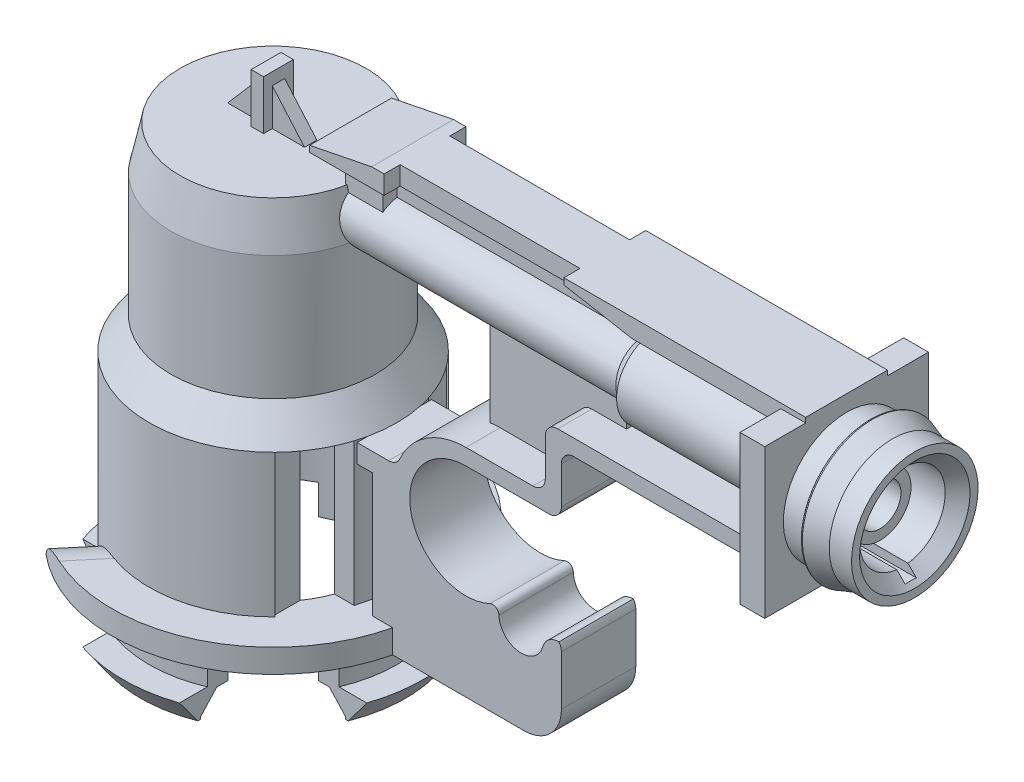
from build123d import *
from build123d.topology import SkipClean

# Parameters (mm, degrees)
SHELL1_T                        = -1.5
CUT_EXTRUDE3_START              = 33.397254902
SKETCH5_R                       = 6.75
CUT_EXTRUDE3_DEPTH              = 33.397254902
SKETCH7_R                       = 6.75
SKETCH7_R_2                     = 6.25
BOSS_EXTRUDE1_DEPTH             = 2.5
SKETCH13_W                      = 13.2
SKETCH13_H                      = 12
BOSS_EXTRUDE2_DEPTH             = 2
BOSS_EXTRUDE3_DEPTH             = 3.3
BOSS_EXTRUDE3_DEPTH_BACK        = 3.3
BOSS_EXTRUDE4_DEPTH             = 2
BOSS_EXTRUDE4_DEPTH_BACK        = 2
SKETCH15_W                      = 20
SKETCH15_H                      = 1.5
BOSS_EXTRUDE5_REACH             = 58.262
BOSS_EXTRUDE5_DIRECTION_2_REACH = 58.262
BOSS_EXTRUDE7_DEPTH             = 0.25
BOSS_EXTRUDE7_DEPTH_BACK        = 0.25
SKETCH17_W                      = 18.5
SKETCH17_H                      = 3.67461891
BOSS_EXTRUDE8_DEPTH             = 1.4
BOSS_EXTRUDE8_DEPTH_BACK        = 1.4
SKETCH19_W                      = 3
SKETCH19_H                      = 3.562043861
BOSS_EXTRUDE9_DEPTH             = 3
BOSS_EXTRUDE9_DEPTH_BACK        = 3
FILLET1_R                       = 1
FILLET3_R                       = 1
FILLET4_R                       = 1
FILLET5_R                       = 0.5
FILLET6_R                       = 1
FILLET7_R                       = 3
SKETCH22_W                      = 3
SKETCH22_H                      = 1.9
BOSS_EXTRUDE10_DEPTH            = 0.25
BOSS_EXTRUDE10_DEPTH_BACK       = 0.25
SKETCH32_W                      = 3
SKETCH32_H                      = 1.9
CUT_REVOLVE1_ANGLE              = 50
CUT_REVOLVE1_OTHER_WAY_ANGLE    = 50
CUT_EXTRUDE5_START              = -0.002745098
CUT_EXTRUDE5_OUTLINE_R          = 31.844450997
CUT_EXTRUDE5_DEPTH              = 4.002745098
FILLET8_R                       = 4
FILLET9_R                       = 4
SKETCH40_R                      = 3.45
CUT_EXTRUDE6_DEPTH              = 5.5
CHAMFER1_SIZE                   = 1
CUT_EXTRUDE7_REACH              = 72.603
SKETCH42_W                      = 0.9
SKETCH42_H                      = 8.2
SKETCH43_R                      = 2.5
BOSS_EXTRUDE11_DEPTH            = 2.7
BOSS_EXTRUDE12_DEPTH            = 0.5
BOSS_EXTRUDE12_DEPTH_BACK       = 0.5
BOSS_EXTRUDE13_DEPTH            = 1.2
BOSS_EXTRUDE13_DEPTH_BACK       = 1.2
SKETCH48_W                      = 4
SKETCH48_H                      = 4
CUT_EXTRUDE9_DEPTH              = 11.497255


with BuildPart() as part:
    # Sketch1 → Revolve1 (revolve)
    with BuildSketch(Plane.XY):
        Polygon((1.5, 7.717254902), (1.5, -27.182745098), (-8.5, -27.182745098), (-8.5, -8.282745098), (-6.75, -5.782745098), (-6.75, 4.217254902), (-6, 7.717254902), align=None)
    revolve(axis=Axis((1.5, 7.717254902, 0), (0, -1, 0)))

    # Shell1
    shell1_openings = [part.faces().sort_by_distance(p)[0] for p in [
        (1.5, -27.182745098, 0),
    ]]
    offset(amount=SHELL1_T, openings=shell1_openings, kind=Kind.INTERSECTION)

    # Sketch5 → Cut-Extrude3 (cut)
    with BuildSketch(Plane(origin=(0, -27.18, 0), x_dir=(1, 0, 0), z_dir=(0, 1, 0)).offset(CUT_EXTRUDE3_START)):
        with Locations(Location((1.5, 0, 0), (0, 0, 180))):
            Circle(SKETCH5_R)
    extrude(amount=-CUT_EXTRUDE3_DEPTH, mode=Mode.SUBTRACT)

    # Sketch7 → Boss-Extrude1 (add)
    with BuildSketch(Plane.XZ.offset(-6.217254902)):
        with Locations((1.5, 0)):
            Circle(SKETCH7_R)
        with Locations((1.5, 0)):
            Circle(SKETCH7_R_2, mode=Mode.SUBTRACT)
    extrude(amount=BOSS_EXTRUDE1_DEPTH)

    # Sketch11 → Revolve2 (revolve)
    with BuildSketch(Plane.XY, mode=Mode.PRIVATE) as revolve2_sk:
        Polygon((-8.5, -27.182745098), (-9.2, -27.182745098), (-10.600415076, -25.182745098), (-8.5, -25.182745098), align=None)
    revolve(revolve2_sk.sketch.rotate(Axis((1.5, 7.717254902, 0), (0, 1, 0)), 180), axis=Axis((1.5, 7.717254902, 0), (0, 1, 0)))

    # Sketch12 → Revolve3 (revolve)
    with SkipClean():  # the faces are left unmerged after this step: merging them gives an invalid solid
        with BuildSketch(Plane.XY):
            Polygon((9, 7.717254902), (31.4, 7.717254902), (32.4, 8.667254902), (45.75, 8.667254902), (45.75, 5.467254902), (9, 5.467254902), (8.8, 5.467254902), (8.8, 7.717254902), align=None)
        revolve(axis=Axis((45.75, 5.467254902, 0), (-1, 0, 0)))

    # Sketch13 → Boss-Extrude2 (add)
    with BuildSketch(Plane(origin=(45.75, 0, 0), x_dir=(0, 0, -1), z_dir=(1, 0, 0))):
        with Locations((0, 5.467254902)):
            Rectangle(SKETCH13_W, SKETCH13_H)
    extrude(amount=BOSS_EXTRUDE2_DEPTH)

    # Sketch14 → Boss-Extrude3 (add, two sides: drawn at the far end of the back side and taken through both)
    with BuildSketch(Plane.XY.offset(-BOSS_EXTRUDE3_DEPTH_BACK)):
        Polygon((47.75, 10.363298717), (33.75, 10.363298717), (28.25, 11.363298717), (28.25, 11.863298717), (47.75, 11.863298717), align=None)
    extrude(amount=BOSS_EXTRUDE3_DEPTH + BOSS_EXTRUDE3_DEPTH_BACK)

    # Sketch15 → Boss-Extrude4 (add, two sides: drawn at the far end of the back side and taken through both)
    with BuildSketch(Plane.XY.offset(-BOSS_EXTRUDE4_DEPTH_BACK)):
        with Locations((23.75, 11.113298717)):
            Rectangle(SKETCH15_W, SKETCH15_H)
    extrude(amount=BOSS_EXTRUDE4_DEPTH + BOSS_EXTRUDE4_DEPTH_BACK)

    # Boss-Extrude5: up to this face of the body (flat: up to its plane)
    boss_extrude5_end = Plane(part.part.faces().sort_by_distance((38.100921754, 11.178465959, 3.3))[0])
    # Sketch16 → Boss-Extrude5 (add, up to the picked face)
    with BuildSketch(Plane.XY, mode=Mode.PRIVATE) as boss_extrude5_sk1:
        Polygon((13.75, 11.863298717), (12.75, 11.863298717), (7.75, 10.863298717), (7.75, 10.363298717), (13.75, 10.363298717), align=None)
    boss_extrude5_tool1 = split(extrude(boss_extrude5_sk1.sketch, amount=BOSS_EXTRUDE5_REACH, mode=Mode.PRIVATE), bisect_by=boss_extrude5_end, keep=Keep.BOTH, mode=Mode.PRIVATE)
    add(boss_extrude5_tool1.solids().sort_by(Axis((11.262821, 10.953042, 0), (0, 0, 1)))[0])

    # Boss-Extrude5 direction 2: up to this face of the body (flat: up to its plane)
    boss_extrude5_direction_2_end = Plane(part.part.faces().sort_by_distance((38.100921754, 11.178465959, -3.3))[0])
    # Sketch16 → Boss-Extrude5 direction 2 (add, up to the picked face)
    with BuildSketch(Plane.XY, mode=Mode.PRIVATE) as boss_extrude5_direction_2_sk1:
        Polygon((13.75, 11.863298717), (12.75, 11.863298717), (7.75, 10.863298717), (7.75, 10.363298717), (13.75, 10.363298717), align=None)
    boss_extrude5_direction_2_tool1 = split(extrude(boss_extrude5_direction_2_sk1.sketch, amount=-BOSS_EXTRUDE5_DIRECTION_2_REACH, mode=Mode.PRIVATE), bisect_by=boss_extrude5_direction_2_end, keep=Keep.BOTH, mode=Mode.PRIVATE)
    add(boss_extrude5_direction_2_tool1.solids().sort_by(Axis((11.262821, 10.953042, 0), (0, 0, -1)))[0])

    # Sketch17 → Boss-Extrude7 (add, two sides: drawn at the far end of the back side and taken through both)
    with BuildSketch(Plane.XY.offset(-BOSS_EXTRUDE7_DEPTH_BACK)):
        with Locations((21, 8.525989262)):
            Rectangle(SKETCH17_W, SKETCH17_H)
    extrude(amount=BOSS_EXTRUDE7_DEPTH + BOSS_EXTRUDE7_DEPTH_BACK)

    # Sketch19 → Boss-Extrude8 (add, two sides: drawn at the far end of the back side and taken through both)
    with BuildSketch(Plane.XY.offset(-BOSS_EXTRUDE8_DEPTH_BACK)):
        with Locations((10.25, 8.582276787)):
            Rectangle(SKETCH19_W, SKETCH19_H)
    extrude(amount=BOSS_EXTRUDE8_DEPTH + BOSS_EXTRUDE8_DEPTH_BACK)

    # Sketch21 → Boss-Extrude9 (add, two sides: drawn at the far end of the back side and taken through both)
    with BuildSketch(Plane.XY.offset(-BOSS_EXTRUDE9_DEPTH_BACK)):
        with BuildLine():
            Line((47.75, -0.532745098), (27.75, -0.532745098))
            Line((27.75, -0.532745098), (27.75, -5.532745098))
            Line((27.75, -5.532745098), (20.057694357, -5.532745098))
            ThreePointArc((20.057694357, -5.532745098), (15.859979082, -11.796072405), (23.248758975, -13.298075789))
            ThreePointArc((23.248758975, -13.298075789), (23.604980618, -16.131341412), (26.25, -15.055162793))
            ThreePointArc((26.25, -15.055162793), (26.732730755, -14.34028924), (27.55, -14.064346929))
            Line((27.55, -14.064346929), (27.75, -14.064346929))
            Line((27.75, -14.064346929), (27.75, -21.68))
            Line((27.75, -21.68), (12.5, -21.68))
            Line((12.5, -21.68), (12.5, -9.782745098))
            Line((12.5, -9.782745098), (11.275044878, -9.782745098))
            Line((11.275044878, -9.782745098), (11.275044878, -8.282745098))
            Line((11.275044878, -8.282745098), (11.5, -8.282745098))
            Line((11.5, -8.282745098), (14.5, -8.282745098))
            ThreePointArc((14.5, -8.282745098), (16.619291146, -5.352656002), (20.057694357, -4.232745098))
            Line((20.057694357, -4.232745098), (26.45, -4.232745098))
            Line((26.45, -4.232745098), (26.45, 0.767254902))
            Line((26.45, 0.767254902), (47.75, 0.767254902))
            Line((47.75, 0.767254902), (47.75, -0.532745098))
        make_face()
    extrude(amount=BOSS_EXTRUDE9_DEPTH + BOSS_EXTRUDE9_DEPTH_BACK)

    # Fillet1
    fillet1_edges = [part.edges().sort_by_distance(p)[0] for p in [
        (27.75, -5.532745098, 0),
        (26.45, -4.232745098, 0),
    ]]
    fillet(fillet1_edges, radius=FILLET1_R)

    # Fillet3
    # the kernel refuses this fillet: 1 mm, written as the material it takes off along each edge
    with BuildSketch(Plane(origin=(27.75, -14.064346929, 4.5), x_dir=(-1, 0, 0), z_dir=(0, 0, -1))) as fillet3_piece_1:
        with BuildLine():
            CenterArc((1, -0.6), FILLET3_R, 143.130102354, 36.869897646)
            Line((0, -0.6), (-0.02, -0.6))
            Line((-0.02, -0.6), (-0.02, 0))
            Line((-0.02, 0), (0, 0.02))
            ThreePointArc((0, 0.02), (0.1, 0.02), (0.184, 0.012))
            Line((0.184, 0.012), (0.2, 0))
        make_face()
    extrude(amount=9, mode=Mode.SUBTRACT)

    # Fillet4
    fillet4_edges = [part.edges().sort_by_distance(p)[0] for p in [
        (27.75, -0.532745098, 0),
        (26.45, 0.767254902, 0),
    ]]
    fillet(fillet4_edges, radius=FILLET4_R)

    # Fillet5
    fillet5_edges = [part.edges().sort_by_distance(p)[0] for p in [
        (23.248758975, -13.298075789, 0),
    ]]
    fillet(fillet5_edges, radius=FILLET5_R)

    # Fillet6
    fillet6_edges = [part.edges().sort_by_distance(p)[0] for p in [
        (14.5, -8.282745098, 0),
    ]]
    fillet(fillet6_edges, radius=FILLET6_R)

    # Fillet7
    fillet7_edges = [part.edges().sort_by_distance(p)[0] for p in [
        (27.75, -21.68, 0),
    ]]
    fillet(fillet7_edges, radius=FILLET7_R)

    # Sketch22 → Revolve4 (revolve)
    with BuildSketch(Plane.XY, mode=Mode.PRIVATE) as revolve4_sk:
        with Locations((-10, -20.73)):
            Rectangle(SKETCH22_W, SKETCH22_H)
    revolve(revolve4_sk.sketch.rotate(Axis((1.5, -25.182745098, 0), (0, 1, 0)), 180), axis=Axis((1.5, -25.182745098, 0), (0, 1, 0)))

    # Sketch23 → Boss-Extrude10 (add, two sides: drawn at the far end of the back side and taken through both)
    with BuildSketch(Plane.XY.offset(-BOSS_EXTRUDE10_DEPTH_BACK)):
        Polygon((30.25, 3.217254902), (30.25, 0.322848826), (27.550920774, 0), (27.020024858, -3.434260731), (25.876556732, -5.149462921), (19.25, -5.149462921), (19.25, 3.217254902), (19.25, 3.761165923), (30.25, 3.761165923), align=None)
    extrude(amount=BOSS_EXTRUDE10_DEPTH + BOSS_EXTRUDE10_DEPTH_BACK)

    # Sketch32 → Cut-Revolve1 (revolve, cut)
    with BuildSketch(Plane.XY):
        with Locations((-10, -20.73)):
            Rectangle(SKETCH32_W, SKETCH32_H)
    revolve(axis=Axis((1.5, 7.717254902, 0), (0, 1, 0)), revolution_arc=CUT_REVOLVE1_ANGLE, mode=Mode.SUBTRACT)

    # Sketch32 → Cut-Revolve1 other way (revolve, cut)
    with BuildSketch(Plane.XY):
        with Locations((-10, -20.73)):
            Rectangle(SKETCH32_W, SKETCH32_H)
    revolve(axis=Axis((1.5, 7.717254902, 0), (0, -1, 0)), revolution_arc=CUT_REVOLVE1_OTHER_WAY_ANGLE, mode=Mode.SUBTRACT)

    # Cut-Extrude5: read off the stored shape, not the designer's step
    # Cut-Extrude5 outline → Cut-Extrude5 (cut)
    with BuildSketch(Plane(origin=(0, -27.18, 0), x_dir=(1, 0, 0), z_dir=(0, 1, 0)).offset(CUT_EXTRUDE5_START)):
        with Locations((1.5, 0)):
            Circle(CUT_EXTRUDE5_OUTLINE_R)
        with BuildLine():
            Line((-6.052483035, -3.9), (-19.004507657, -3.9))
            Line((-19.004507657, -3.9), (-19.004507657, 3.9))
            Line((-19.004507657, 3.9), (-6.052483035, 3.9))
            ThreePointArc((-6.052483035, 3.9), (-4.51040764, 6.01040764), (-2.4, 7.552483035))
            Line((-2.4, 7.552483035), (-2.4, 21.350285955))
            Line((-2.4, 21.350285955), (5.4, 21.350285955))
            Line((5.4, 21.350285955), (5.4, 7.552483035))
            ThreePointArc((5.4, 7.552483035), (7.51040764, 6.01040764), (9.052483035, 3.9))
            Line((9.052483035, 3.9), (22.004507657, 3.9))
            Line((22.004507657, 3.9), (22.004507657, -3.9))
            Line((22.004507657, -3.9), (9.052483035, -3.9))
            ThreePointArc((9.052483035, -3.9), (7.51040764, -6.01040764), (5.4, -7.552483035))
            Line((5.4, -7.552483035), (5.4, -21.350285955))
            Line((5.4, -21.350285955), (-2.4, -21.350285955))
            Line((-2.4, -21.350285955), (-2.4, -7.552483035))
            ThreePointArc((-2.4, -7.552483035), (-4.51040764, -6.01040764), (-6.052483035, -3.9))
        make_face(mode=Mode.SUBTRACT)
    extrude(amount=CUT_EXTRUDE5_DEPTH, mode=Mode.SUBTRACT)

    # Fillet8
    # the kernel refuses this fillet: 4 mm, written as the material it takes off along each edge
    with BuildSketch(Plane(origin=(0.542903561, -19.78, 1.14062312), x_dir=(0, -1, 0), z_dir=(-0.6427876096865379, 0, 0.7660444431189792))) as fillet8_piece_1_section:
        with BuildLine():
            CenterArc((4, 3.404408906), FILLET8_R, 180, 58.331756746)
            Line((0, 3.404408906), (0, 0))
            Line((0, 0), (1.9, 0))
        make_face()
    fillet8_piece_1 = extrude(amount=20.022044531, mode=Mode.PRIVATE)
    fillet8_piece_1 = fillet8_piece_1 - Plane(origin=(1.5, -19.78, 0), x_dir=(-1, 0, 0), z_dir=(0, 1, 0)) * Cylinder(10, 54, mode=Mode.PRIVATE)
    add(fillet8_piece_1, mode=Mode.SUBTRACT)

    # Fillet9
    # the kernel refuses this fillet: 4 mm, written as the material it takes off along each edge
    with BuildSketch(Plane(origin=(0.542903561, -19.78, -1.14062312), x_dir=(0.7660444431189792, 0, -0.6427876096865379), z_dir=(-0.6427876096865379, 0, -0.7660444431189792))) as fillet9_piece_1_section:
        with BuildLine():
            CenterArc((3.404408906, 4), FILLET9_R, 211.668243254, 58.331756746)
            Line((0, 1.9), (0, 0))
            Line((0, 0), (3.404408906, 0))
        make_face()
    fillet9_piece_1 = extrude(amount=20.022044531, mode=Mode.PRIVATE)
    fillet9_piece_1 = fillet9_piece_1 - Plane(origin=(1.5, -19.78, 0), x_dir=(-1, 0, 0), z_dir=(0, 1, 0)) * Cylinder(10, 54, mode=Mode.PRIVATE)
    add(fillet9_piece_1, mode=Mode.SUBTRACT)

    # Sketch38 → Cut-Revolve2 (revolve, cut)
    with BuildSketch(Plane.XY, mode=Mode.PRIVATE) as cut_revolve2_sk:
        Polygon((1.5, -25.579631782), (1.5, -29.139743627), (-9, -29.139743627), (-9, -27.007866965), (-7.8, -25.579631782), align=None)
    revolve(cut_revolve2_sk.sketch.rotate(Axis((1.5, 7.717254902, 0), (0, 1, 0)), 180), axis=Axis((1.5, 7.717254902, 0), (0, 1, 0)), mode=Mode.SUBTRACT)

    # Sketch39 → Revolve7 (revolve)
    with BuildSketch(Plane.XY):
        with BuildLine():
            Line((47.75, 5.467254902), (47.75, 10.567254902))
            Line((47.75, 10.567254902), (49.55, 10.567254902))
            Line((49.55, 10.567254902), (49.55, 10.767254902))
            Line((49.55, 10.767254902), (49.651722542, 10.997924534))
            ThreePointArc((49.651722542, 10.997924534), (49.725493918, 11.084766154), (49.834718836, 11.117225362))
            Line((49.834718836, 11.117225362), (51.45, 10.567254902))
            Line((51.45, 10.567254902), (53.25, 10.567254902))
            Line((53.25, 10.567254902), (53.25, 5.467254902))
            Line((53.25, 5.467254902), (47.75, 5.467254902))
        make_face()
    revolve(axis=Axis((53.25, 5.467254902, 0), (-1, 0, 0)))

    # Sketch40 → Cut-Extrude6 (cut)
    with BuildSketch(Plane(origin=(53.25, 0, 0), x_dir=(0, 0, -1), z_dir=(1, 0, 0))):
        with Locations(Location((0, 5.467254902, 0), (0, 0, 90))):
            Circle(SKETCH40_R)
    extrude(amount=-CUT_EXTRUDE6_DEPTH, mode=Mode.SUBTRACT)

    # Chamfer1
    chamfer1_edges = [part.edges().sort_by_distance(p)[0] for p in [
        (53.25, 2.017254902, 0),
    ]]
    chamfer(chamfer1_edges, length=CHAMFER1_SIZE)

    # Cut-Extrude7: up to this face of the body (flat: up to its plane)
    cut_extrude7_end = Plane(part.part.faces().sort_by_distance((47.75, 5.467254902, 0))[0])
    # Sketch42 → Cut-Extrude7 (cut, up to the picked face)
    with BuildSketch(Plane(origin=(53.25, 0, 0), x_dir=(0, 0, -1), z_dir=(1, 0, 0)), mode=Mode.PRIVATE) as cut_extrude7_sk1:
        with Locations((0, 5.467254902)):
            Rectangle(SKETCH42_W, SKETCH42_H)
    cut_extrude7_tool1 = split(extrude(cut_extrude7_sk1.sketch, amount=-CUT_EXTRUDE7_REACH, mode=Mode.PRIVATE), bisect_by=cut_extrude7_end, keep=Keep.BOTH, mode=Mode.PRIVATE)
    add(cut_extrude7_tool1.solids().sort_by(Axis((53.25, 5.467255, 0), (-1, 0, 0)))[0], mode=Mode.SUBTRACT)

    # Sketch43 → Boss-Extrude11 (add)
    with BuildSketch(Plane(origin=(47.75, 0, 0), x_dir=(0, 0, -1), z_dir=(1, 0, 0))):
        with Locations(Location((0, 5.467254902, 0), (0, 0, 180))):
            Circle(SKETCH43_R)
    extrude(amount=BOSS_EXTRUDE11_DEPTH)

    # Sketch45 → Cut-Revolve3 (revolve, cut)
    with BuildSketch(Plane.XY, mode=Mode.PRIVATE) as cut_revolve3_sk:
        Polygon((53.25, 5.467254902), (7.042638454, 5.467254902), (7.042638454, 6.217254902), (38.685920052, 6.217254902), (41.25, 7.150503681), (53.25, 7.150503681), align=None)
    revolve(cut_revolve3_sk.sketch.rotate(Axis((53.25, 5.467254902, 0), (-1, 0, 0)), 90), axis=Axis((53.25, 5.467254902, 0), (-1, 0, 0)), mode=Mode.SUBTRACT)

    # Sketch46 → Boss-Extrude12 (add, two sides: drawn at the far end of the back side and taken through both)
    with BuildSketch(Plane.XY.offset(-BOSS_EXTRUDE12_DEPTH_BACK)):
        Polygon((1.434087404, 10.717254902), (0.934087404, 10.717254902), (-1.665912596, 7.717254902), (-1.665912596, 7.517254902), (1.434087404, 7.517254902), (4.534087404, 7.517254902), (4.534087404, 7.717254902), (1.934087404, 10.717254902), align=None)
    extrude(amount=BOSS_EXTRUDE12_DEPTH + BOSS_EXTRUDE12_DEPTH_BACK)

    # Sketch47 → Boss-Extrude13 (add, two sides: drawn at the far end of the back side and taken through both)
    with BuildSketch(Plane.XY.offset(-BOSS_EXTRUDE13_DEPTH_BACK)):
        Polygon((1.934087404, 10.717254902), (1.934087404, 11.697254902), (0.934087404, 11.697254902), (0.934087404, 10.717254902), (0.934087404, 7.717254902), (1.934087404, 7.717254902), align=None)
    extrude(amount=BOSS_EXTRUDE13_DEPTH + BOSS_EXTRUDE13_DEPTH_BACK)

    # Sketch48 → Cut-Extrude9 (cut)
    with BuildSketch(Plane(origin=(0, -19.78, 0), x_dir=(1, 0, 0), z_dir=(0, 1, 0))):
        with Locations((10.5, -5)):
            Rectangle(SKETCH48_W, SKETCH48_H)
    cut_extrude9 = extrude(amount=CUT_EXTRUDE9_DEPTH, mode=Mode.SUBTRACT)

    # Mirror1: Cut-Extrude9 across plane
    add(cut_extrude9.mirror(Plane.XY), mode=Mode.SUBTRACT)


solid = part.part
